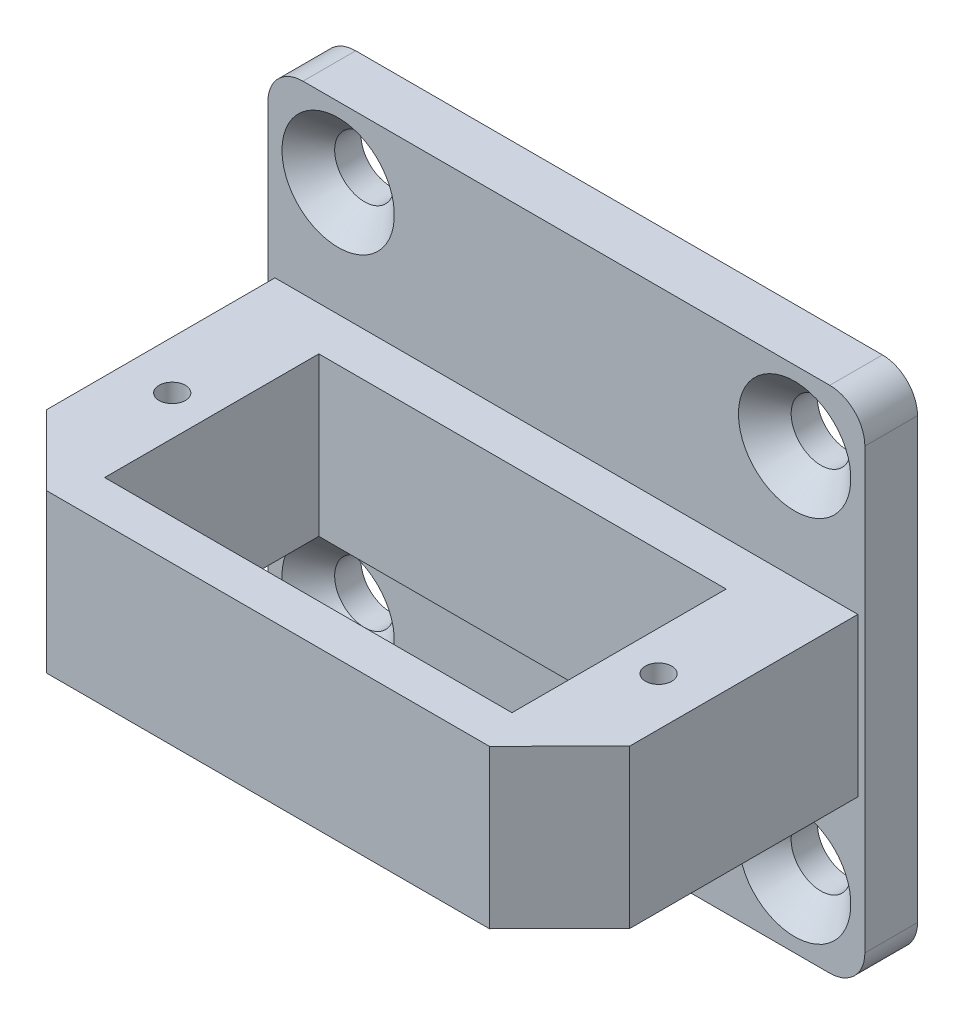
from build123d import *

# Parameters (mm, degrees)
SKETCH1_W                = 34
SKETCH1_H                = 29
SKETCH1_R                = 1.7
BOSS_EXTRUDE1_DEPTH      = 3
BOSS_EXTRUDE2_DEPTH      = 5
BOSS_EXTRUDE2_DEPTH_BACK = 4
SKETCH3_R                = 0.75
SKETCH3_W                = 23.2
SKETCH3_H                = 12.2
FILLET1_R                = 2
CHAMFER1_SIZE            = 1.5


with BuildPart() as part:
    # Sketch1 → Boss-Extrude1 (new body)
    with BuildSketch(Plane.XY):
        Rectangle(SKETCH1_W, SKETCH1_H)
        with Locations((-13, 10.5)):
            Circle(SKETCH1_R, mode=Mode.SUBTRACT)
        with Locations((13, 10.5)):
            Circle(SKETCH1_R, mode=Mode.SUBTRACT)
        with Locations((13, -10.5)):
            Circle(SKETCH1_R, mode=Mode.SUBTRACT)
        with Locations((-13, -10.5)):
            Circle(SKETCH1_R, mode=Mode.SUBTRACT)
    extrude(amount=BOSS_EXTRUDE1_DEPTH)

    # Sketch3 → Boss-Extrude2 (add, two sides: drawn at the far end of the back side and taken through both)
    with BuildSketch(Plane(origin=(0, 0, 0), x_dir=(-1, 0, 0), z_dir=(0, -1, 0)).offset(-BOSS_EXTRUDE2_DEPTH_BACK)):
        Polygon((16.6, -3), (16.6, -16), (12.612805852, -20), (-12.612805852, -20), (-16.6, -16), (-16.6, -3), align=None)
        with Locations((-13.85, -11.6)):
            Circle(SKETCH3_R, mode=Mode.SUBTRACT)
        with Locations((13.85, -11.6)):
            Circle(SKETCH3_R, mode=Mode.SUBTRACT)
        with Locations((0, -11.6)):
            Rectangle(SKETCH3_W, SKETCH3_H, mode=Mode.SUBTRACT)
    extrude(amount=BOSS_EXTRUDE2_DEPTH + BOSS_EXTRUDE2_DEPTH_BACK)

    # Fillet1
    fillet1_edges = [part.edges().sort_by_distance(p)[0] for p in [
        (-17, 14.5, 1.5),
        (-17, -14.5, 1.5),
        (17, 14.5, 1.5),
        (17, -14.5, 1.5),
    ]]
    fillet(fillet1_edges, radius=FILLET1_R)

    # Chamfer1
    chamfer1_edges = [part.edges().sort_by_distance(p)[0] for p in [
        (-14.7, 10.5, 3),
        (-14.7, -10.5, 3),
        (11.3, -10.5, 3),
        (11.3, 10.5, 3),
    ]]
    chamfer(chamfer1_edges, length=CHAMFER1_SIZE)


solid = part.part
